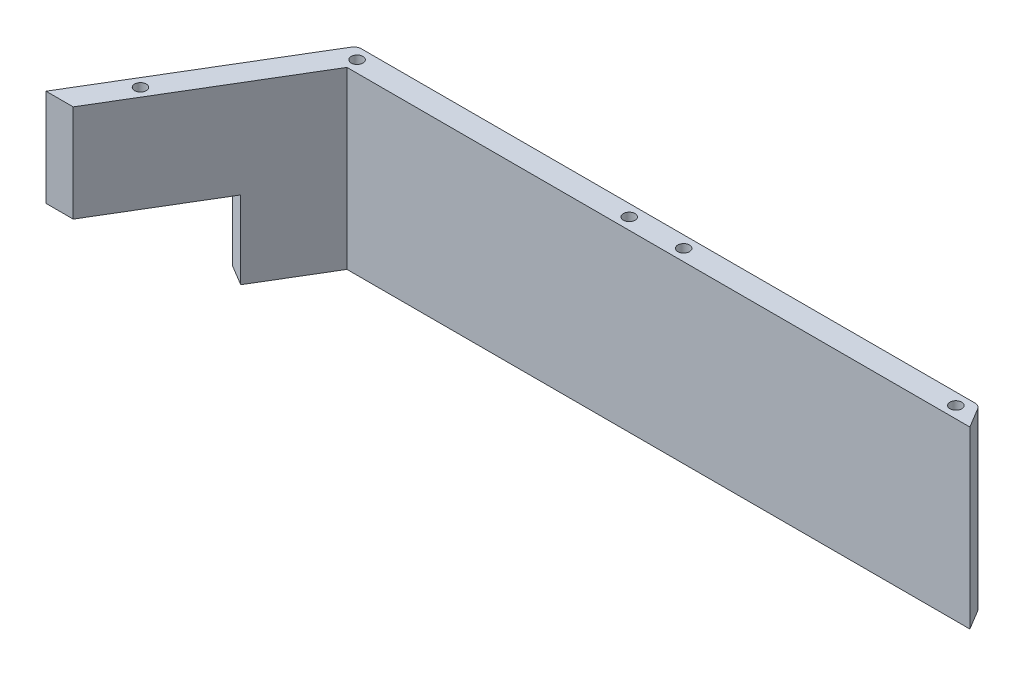
from build123d import *

# Parameters (mm, degrees)
BOSS_EXTRUDE1_DEPTH = 22.5
SKETCH2_R           = 1.5
CUT_EXTRUDE1_DEPTH  = 5
FILLET1_R           = 2
SKETCH3_W           = 35
SKETCH3_H           = 20
CUT_EXTRUDE2_DEPTH  = 10
SKETCH6_W           = 44
SKETCH6_H           = 45
CUT_EXTRUDE3_DEPTH  = 123.907485533


with BuildPart() as part:
    # Sketch1 → Boss-Extrude1 (new, symmetric)
    with BuildSketch(Plane(origin=(0, 0, 0), x_dir=(1, 0, 0), z_dir=(0, 1, 0))):
        Polygon((-110, 0), (-80, 50), (80, 50), (110, 0), (103, 0), (76.6, 44), (-76.6, 44), (-103, 0), align=None)
    extrude(amount=BOSS_EXTRUDE1_DEPTH, both=True)

    # Sketch2 → Cut-Extrude1 (cut)
    with BuildSketch(Plane(origin=(0, 22.5, 0), x_dir=(1, 0, 0), z_dir=(0, 1, 0))):
        with Locations((-98.701428863, 13)):
            Circle(SKETCH2_R)
        with Locations((-77, 47)):
            Circle(SKETCH2_R)
        with Locations((-7, 47)):
            Circle(SKETCH2_R)
        with Locations((7, 47)):
            Circle(SKETCH2_R)
        with Locations((77, 47)):
            Circle(SKETCH2_R)
        with Locations((98.701428863, 13)):
            Circle(SKETCH2_R)
    extrude(amount=-CUT_EXTRUDE1_DEPTH, mode=Mode.SUBTRACT)

    # Fillet1
    fillet1_edges = [part.edges().sort_by_distance(p)[0] for p in [
        (80, 0, -50),
        (-80, 0, -50),
    ]]
    fillet(fillet1_edges, radius=FILLET1_R)

    # Sketch3 → Cut-Extrude2 (cut)
    with BuildSketch(Plane(origin=(-80.882352941, 0, -48.529411765), x_dir=(-0.5144957554275265, 0, 0.8574929257125443), z_dir=(-0.8574929257125443, 0, -0.5144957554275265))):
        with Locations((39.094533097, -12.5)):
            Rectangle(SKETCH3_W, SKETCH3_H)
    extrude(amount=-CUT_EXTRUDE2_DEPTH, mode=Mode.SUBTRACT)

    # Sketch6 → Cut-Extrude3 (cut, through all)
    with BuildSketch(Plane(origin=(0, 0, 0), x_dir=(0, 0, -1), z_dir=(1, 0, 0))):
        with Locations((22, 0)):
            Rectangle(SKETCH6_W, SKETCH6_H)
    extrude(amount=CUT_EXTRUDE3_DEPTH, mode=Mode.SUBTRACT)


solid = part.part
